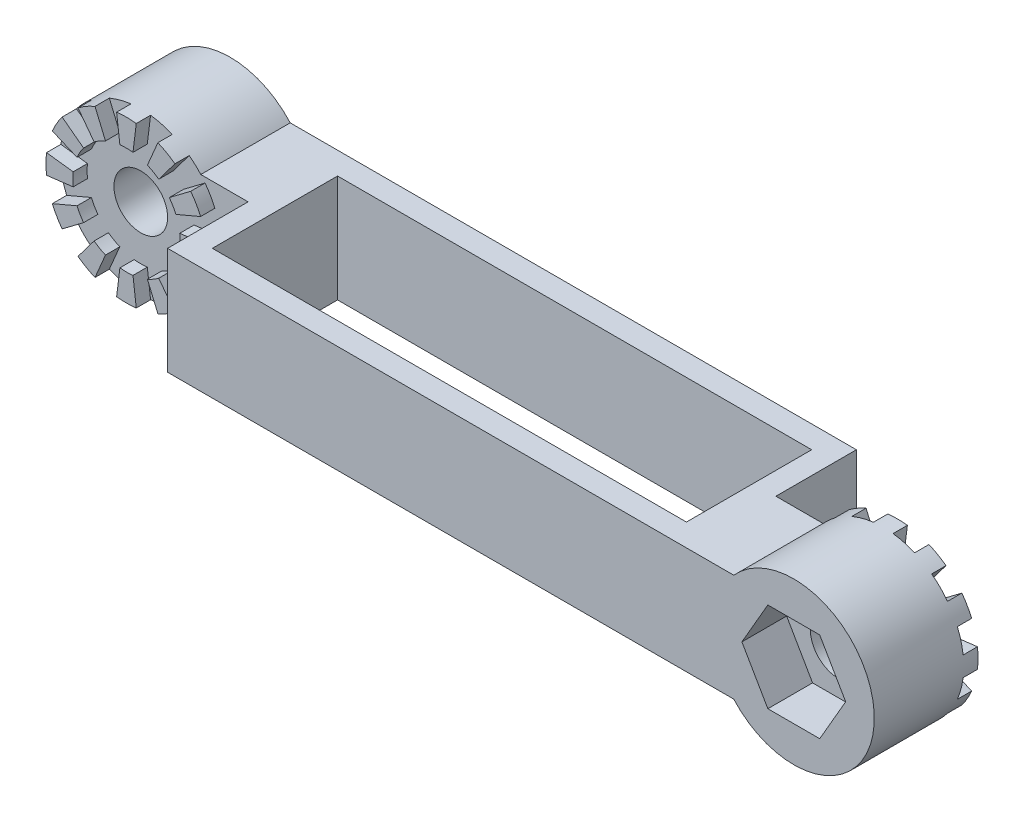
from build123d import *
from build123d.topology import SkipClean

# Parameters (mm, degrees)
CROQUIS1_W              = 53
CROQUIS1_H              = 14
SALIENTE_EXTRUIR1_DEPTH = 12
CROQUIS2_R              = 9
SALIENTE_EXTRUIR2_DEPTH = 10
CORTAR_EXTRUIR3_DEPTH   = 5
CROQUIS5_R              = 3.15
CORTAR_EXTRUIR4_DEPTH   = 10
CROQUIS6_R              = 9
SALIENTE_EXTRUIR3_DEPTH = 10
CROQUIS3_R              = 3
CORTAR_EXTRUIR5_DEPTH   = 30
SALIENTE_EXTRUIR4_DEPTH = 1.6
SALIENTE_EXTRUIR5_DEPTH = 1.6
CORTAR_EXTRUIR6_START   = -10
CORTAR_EXTRUIR6_DEPTH   = 10
CORTAR_EXTRUIR7_START   = -10
CORTAR_EXTRUIR7_DEPTH   = 10


# Read off the part's stored shape, not the designer's step: Cortar-Extruir6, Cortar-Extruir7
with BuildPart() as part:
    # Croquis1 → Saliente-Extruir1 (new body)
    with BuildSketch(Plane(origin=(0, 0, 0), x_dir=(1, 0, 0), z_dir=(0, 1, 0))):
        Polygon((0, 0), (21, 0), (21, -9), (100, -9), (100, 1), (79, 1), (79, 10), (0, 10), align=None)
        with Locations((50, 0.5)):
            Rectangle(CROQUIS1_W, CROQUIS1_H, mode=Mode.SUBTRACT)
    extrude(amount=SALIENTE_EXTRUIR1_DEPTH)

    # Croquis2 → Saliente-Extruir2 (add)
    with BuildSketch(Plane.XY):
        with Locations((9, 6)):
            Circle(CROQUIS2_R)
    extrude(amount=-SALIENTE_EXTRUIR2_DEPTH)

    # Croquis4 → Cortar-Extruir3 (cut)
    with BuildSketch(Plane.XY.offset(9)):
        Polygon((96.8, 6), (93.9, 11.022947342), (88.1, 11.022947342), (85.2, 6), (88.1, 0.977052658), (93.9, 0.977052658), align=None)
    extrude(amount=-CORTAR_EXTRUIR3_DEPTH, mode=Mode.SUBTRACT)

    # Croquis5 → Cortar-Extruir4 (cut)
    with BuildSketch(Plane.XY.offset(4)):
        with Locations((91, 6)):
            Circle(CROQUIS5_R)
    extrude(amount=-CORTAR_EXTRUIR4_DEPTH, mode=Mode.SUBTRACT)

    # Croquis6 → Saliente-Extruir3 (add)
    with BuildSketch(Plane.XY.offset(9)):
        with Locations((91, 6)):
            Circle(CROQUIS6_R)
        Polygon((96.8, 6), (93.9, 11.022947342), (88.1, 11.022947342), (85.2, 6), (88.1, 0.977052658), (93.9, 0.977052658), align=None, mode=Mode.SUBTRACT)
    extrude(amount=-SALIENTE_EXTRUIR3_DEPTH)

    # Croquis3 → Cortar-Extruir5 (cut)
    with BuildSketch(Plane.XY):
        with Locations((9, 6)):
            Circle(CROQUIS3_R)
    extrude(amount=-CORTAR_EXTRUIR5_DEPTH, mode=Mode.SUBTRACT)

    # Croquis7 → Saliente-Extruir4 (add, symmetric)
    with SkipClean():  # the faces are left unmerged after this step: merging them gives an invalid solid
        with BuildSketch(Plane.XY):
            with BuildLine():
                Line((8.26878394, 11.95527691), (7.903175909, 14.932915365))
                ThreePointArc((7.903175909, 14.932915365), (9, 15), (10.096824091, 14.932915365))
                Line((10.096824091, 14.932915365), (9.73121606, 11.95527691))
                ThreePointArc((9.73121606, 11.95527691), (9, 12), (8.26878394, 11.95527691))
            make_face()
            with BuildLine():
                Line((12.610890139, 10.79181306), (14.416335208, 13.18771959))
                ThreePointArc((14.416335208, 13.18771959), (13.5, 13.794228634), (12.516580156, 14.284543681))
                Line((12.516580156, 14.284543681), (11.344386771, 11.523029121))
                ThreePointArc((11.344386771, 11.523029121), (12, 11.196152423), (12.610890139, 10.79181306))
            make_face()
            with BuildLine():
                Line((14.523029121, 8.344386771), (17.284543681, 9.516580156))
                ThreePointArc((17.284543681, 9.516580156), (16.794228634, 10.5), (16.18771959, 11.416335208))
                Line((16.18771959, 11.416335208), (13.79181306, 9.610890139))
                ThreePointArc((13.79181306, 9.610890139), (14.196152423, 9), (14.523029121, 8.344386771))
            make_face()
            with BuildLine():
                Line((14.95527691, 5.26878394), (17.932915365, 4.903175909))
                ThreePointArc((17.932915365, 4.903175909), (18, 6), (17.932915365, 7.096824091))
                Line((17.932915365, 7.096824091), (14.95527691, 6.73121606))
                ThreePointArc((14.95527691, 6.73121606), (15, 6), (14.95527691, 5.26878394))
            make_face()
            with BuildLine():
                Line((13.79181306, 2.389109861), (16.18771959, 0.583664792))
                ThreePointArc((16.18771959, 0.583664792), (16.794228634, 1.5), (17.284543681, 2.483419844))
                Line((17.284543681, 2.483419844), (14.523029121, 3.655613229))
                ThreePointArc((14.523029121, 3.655613229), (14.196152423, 3), (13.79181306, 2.389109861))
            make_face()
            with BuildLine():
                Line((11.344386771, 0.476970879), (12.516580156, -2.284543681))
                ThreePointArc((12.516580156, -2.284543681), (13.5, -1.794228634), (14.416335208, -1.18771959))
                Line((14.416335208, -1.18771959), (12.610890139, 1.20818694))
                ThreePointArc((12.610890139, 1.20818694), (12, 0.803847577), (11.344386771, 0.476970879))
            make_face()
            with BuildLine():
                Line((8.26878394, 0.04472309), (7.903175909, -2.932915365))
                ThreePointArc((7.903175909, -2.932915365), (9, -3), (10.096824091, -2.932915365))
                Line((10.096824091, -2.932915365), (9.73121606, 0.04472309))
                ThreePointArc((9.73121606, 0.04472309), (9, 0), (8.26878394, 0.04472309))
            make_face()
            with BuildLine():
                Line((5.389109861, 1.20818694), (3.583664792, -1.18771959))
                ThreePointArc((3.583664792, -1.18771959), (4.5, -1.794228634), (5.483419844, -2.284543681))
                Line((5.483419844, -2.284543681), (6.655613229, 0.476970879))
                ThreePointArc((6.655613229, 0.476970879), (6, 0.803847577), (5.389109861, 1.20818694))
            make_face()
            with BuildLine():
                Line((3.476970879, 3.655613229), (0.715456319, 2.483419844))
                ThreePointArc((0.715456319, 2.483419844), (1.205771366, 1.5), (1.81228041, 0.583664792))
                Line((1.81228041, 0.583664792), (4.20818694, 2.389109861))
                ThreePointArc((4.20818694, 2.389109861), (3.803847577, 3), (3.476970879, 3.655613229))
            make_face()
            with BuildLine():
                Line((3.04472309, 6.73121606), (0.067084635, 7.096824091))
                ThreePointArc((0.067084635, 7.096824091), (0, 6), (0.067084635, 4.903175909))
                Line((0.067084635, 4.903175909), (3.04472309, 5.26878394))
                ThreePointArc((3.04472309, 5.26878394), (3, 6), (3.04472309, 6.73121606))
            make_face()
            with BuildLine():
                Line((4.20818694, 9.610890139), (1.81228041, 11.416335208))
                ThreePointArc((1.81228041, 11.416335208), (1.205771366, 10.5), (0.715456319, 9.516580156))
                Line((0.715456319, 9.516580156), (3.476970879, 8.344386771))
                ThreePointArc((3.476970879, 8.344386771), (3.803847577, 9), (4.20818694, 9.610890139))
            make_face()
            with BuildLine():
                Line((6.655613229, 11.523029121), (5.483419844, 14.284543681))
                ThreePointArc((5.483419844, 14.284543681), (4.5, 13.794228634), (3.583664792, 13.18771959))
                Line((3.583664792, 13.18771959), (5.389109861, 10.79181306))
                ThreePointArc((5.389109861, 10.79181306), (6, 11.196152423), (6.655613229, 11.523029121))
            make_face()
        extrude(amount=SALIENTE_EXTRUIR4_DEPTH, both=True)

    # Croquis8 → Saliente-Extruir5 (add, symmetric)
    with SkipClean():  # the faces are left unmerged after this step: merging them gives an invalid solid
        with BuildSketch(Plane(origin=(0, 0, -1), x_dir=(-1, 0, 0), z_dir=(0, 0, -1))):
            with BuildLine():
                Line((-91.73121606, 11.95527691), (-92.096824091, 14.932915365))
                ThreePointArc((-92.096824091, 14.932915365), (-91, 15), (-89.903175909, 14.932915365))
                Line((-89.903175909, 14.932915365), (-90.26878394, 11.95527691))
                ThreePointArc((-90.26878394, 11.95527691), (-91, 12), (-91.73121606, 11.95527691))
            make_face()
            with BuildLine():
                Line((-87.389109861, 10.79181306), (-85.583664792, 13.18771959))
                ThreePointArc((-85.583664792, 13.18771959), (-86.5, 13.794228634), (-87.483419844, 14.284543681))
                Line((-87.483419844, 14.284543681), (-88.655613229, 11.523029121))
                ThreePointArc((-88.655613229, 11.523029121), (-88, 11.196152423), (-87.389109861, 10.79181306))
            make_face()
            with BuildLine():
                Line((-85.476970879, 8.344386771), (-82.715456319, 9.516580156))
                ThreePointArc((-82.715456319, 9.516580156), (-83.205771366, 10.5), (-83.81228041, 11.416335208))
                Line((-83.81228041, 11.416335208), (-86.20818694, 9.610890139))
                ThreePointArc((-86.20818694, 9.610890139), (-85.803847577, 9), (-85.476970879, 8.344386771))
            make_face()
            with BuildLine():
                Line((-85.04472309, 5.26878394), (-82.067084635, 4.903175909))
                ThreePointArc((-82.067084635, 4.903175909), (-82, 6), (-82.067084635, 7.096824091))
                Line((-82.067084635, 7.096824091), (-85.04472309, 6.73121606))
                ThreePointArc((-85.04472309, 6.73121606), (-85, 6), (-85.04472309, 5.26878394))
            make_face()
            with BuildLine():
                Line((-86.20818694, 2.389109861), (-83.81228041, 0.583664792))
                ThreePointArc((-83.81228041, 0.583664792), (-83.205771366, 1.5), (-82.715456319, 2.483419844))
                Line((-82.715456319, 2.483419844), (-85.476970879, 3.655613229))
                ThreePointArc((-85.476970879, 3.655613229), (-85.803847577, 3), (-86.20818694, 2.389109861))
            make_face()
            with BuildLine():
                Line((-88.655613229, 0.476970879), (-87.483419844, -2.284543681))
                ThreePointArc((-87.483419844, -2.284543681), (-86.5, -1.794228634), (-85.583664792, -1.18771959))
                Line((-85.583664792, -1.18771959), (-87.389109861, 1.20818694))
                ThreePointArc((-87.389109861, 1.20818694), (-88, 0.803847577), (-88.655613229, 0.476970879))
            make_face()
            with BuildLine():
                Line((-91.73121606, 0.04472309), (-92.096824091, -2.932915365))
                ThreePointArc((-92.096824091, -2.932915365), (-91, -3), (-89.903175909, -2.932915365))
                Line((-89.903175909, -2.932915365), (-90.26878394, 0.04472309))
                ThreePointArc((-90.26878394, 0.04472309), (-91, 0), (-91.73121606, 0.04472309))
            make_face()
            with BuildLine():
                Line((-94.610890139, 1.20818694), (-96.416335208, -1.18771959))
                ThreePointArc((-96.416335208, -1.18771959), (-95.5, -1.794228634), (-94.516580156, -2.284543681))
                Line((-94.516580156, -2.284543681), (-93.344386771, 0.476970879))
                ThreePointArc((-93.344386771, 0.476970879), (-94, 0.803847577), (-94.610890139, 1.20818694))
            make_face()
            with BuildLine():
                Line((-96.523029121, 3.655613229), (-99.284543681, 2.483419844))
                ThreePointArc((-99.284543681, 2.483419844), (-98.794228634, 1.5), (-98.18771959, 0.583664792))
                Line((-98.18771959, 0.583664792), (-95.79181306, 2.389109861))
                ThreePointArc((-95.79181306, 2.389109861), (-96.196152423, 3), (-96.523029121, 3.655613229))
            make_face()
            with BuildLine():
                Line((-96.95527691, 6.73121606), (-99.932915365, 7.096824091))
                ThreePointArc((-99.932915365, 7.096824091), (-100, 6), (-99.932915365, 4.903175909))
                Line((-99.932915365, 4.903175909), (-96.95527691, 5.26878394))
                ThreePointArc((-96.95527691, 5.26878394), (-97, 6), (-96.95527691, 6.73121606))
            make_face()
            with BuildLine():
                Line((-95.79181306, 9.610890139), (-98.18771959, 11.416335208))
                ThreePointArc((-98.18771959, 11.416335208), (-98.794228634, 10.5), (-99.284543681, 9.516580156))
                Line((-99.284543681, 9.516580156), (-96.523029121, 8.344386771))
                ThreePointArc((-96.523029121, 8.344386771), (-96.196152423, 9), (-95.79181306, 9.610890139))
            make_face()
            with BuildLine():
                Line((-93.344386771, 11.523029121), (-94.516580156, 14.284543681))
                ThreePointArc((-94.516580156, 14.284543681), (-95.5, 13.794228634), (-96.416335208, 13.18771959))
                Line((-96.416335208, 13.18771959), (-94.610890139, 10.79181306))
                ThreePointArc((-94.610890139, 10.79181306), (-94, 11.196152423), (-93.344386771, 11.523029121))
            make_face()
        extrude(amount=SALIENTE_EXTRUIR5_DEPTH, both=True)

    # Cortar-Extruir6 outline → Cortar-Extruir6 (cut)
    with SkipClean():  # the faces are left unmerged after this step: merging them gives an invalid solid
        with BuildSketch(Plane(origin=(0, 0, -10), x_dir=(-1, 0, 0), z_dir=(0, 0, -1)).offset(CORTAR_EXTRUIR6_START)):
            with BuildLine():
                Line((0, 12), (-2.291796068, 12))
                ThreePointArc((-2.291796068, 12), (-0.59244875, 9.211398758), (0, 5.999999893))
                Line((0, 5.999999893), (0, 12))
            make_face()
            with BuildLine():
                Line((0, 0), (0, 5.999999893))
                ThreePointArc((0, 5.999999893), (-0.592448789, 2.788601142), (-2.291796068, 0))
                Line((-2.291796068, 0), (0, 0))
            make_face()
        extrude(amount=CORTAR_EXTRUIR6_DEPTH, mode=Mode.SUBTRACT)

    # Cortar-Extruir7 outline → Cortar-Extruir7 (cut)
    with SkipClean():  # the faces are left unmerged after this step: merging them gives an invalid solid
        with BuildSketch(Plane(origin=(0, 0, -1), x_dir=(-1, 0, 0), z_dir=(0, 0, -1)).offset(CORTAR_EXTRUIR7_START)):
            with BuildLine():
                Line((-100, 0), (-97.708203932, 0))
                ThreePointArc((-97.708203932, 0), (-99.407551231, 2.788601192), (-100, 6))
                Line((-100, 6), (-100, 0))
            make_face()
            with BuildLine():
                Line((-100, 12), (-100, 6))
                ThreePointArc((-100, 6), (-99.407551231, 9.211398808), (-97.708203932, 12))
                Line((-97.708203932, 12), (-100, 12))
            make_face()
        extrude(amount=CORTAR_EXTRUIR7_DEPTH, mode=Mode.SUBTRACT)


solid = part.part
